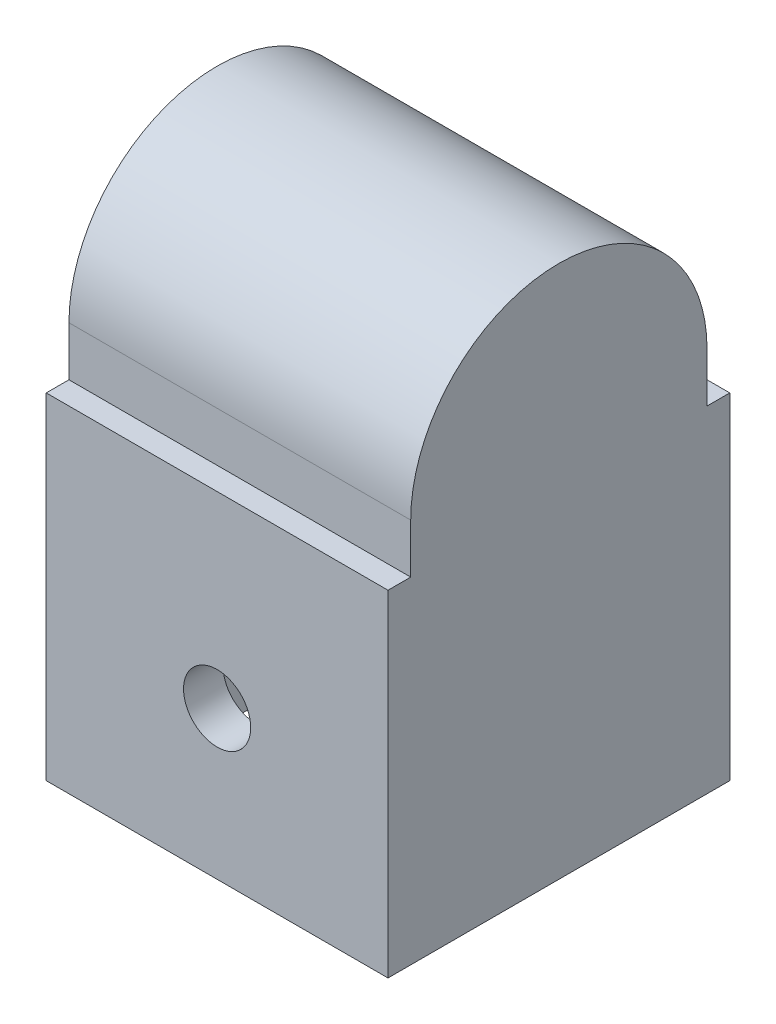
from build123d import *

# Parameters (mm, degrees)
CROQUIS3_W                   = 17.3
CROQUIS3_H                   = 17.3
CROQUIS3_W_2                 = 13.3
CROQUIS3_H_2                 = 13.3
SALIENTE_EXTRUIR1_DEPTH      = 15
CROQUIS3_2_W                 = 17.3
CROQUIS3_2_H                 = 17.3
CROQUIS3_2_W_2               = 13.3
CROQUIS3_2_H_2               = 13.3
SALIENTE_EXTRUIR2_DEPTH      = 2
CORTAR_EXTRUIR1_DEPTH        = 20.3557485
CORTAR_EXTRUIR1_DEPTH_BACK   = 20.3557485
CROQUIS5_R                   = 1.7
SALIENTE_EXTRUIR4_DEPTH      = 8.65
SALIENTE_EXTRUIR4_DEPTH_BACK = 8.65
VACIADO1_START               = -6.65
VACIADO1_DEPTH               = 13.3


# Read off the part's stored shape, not the designer's step: Vaciado1
with BuildPart() as part:
    # Croquis3 → Saliente-Extruir1 (new body)
    with BuildSketch(Plane(origin=(0, 0, 0), x_dir=(1, 0, 0), z_dir=(0, 1, 0))):
        Rectangle(CROQUIS3_W, CROQUIS3_H)
        Rectangle(CROQUIS3_W_2, CROQUIS3_H_2, mode=Mode.SUBTRACT)
    extrude(amount=-SALIENTE_EXTRUIR1_DEPTH)

    # Croquis3<2> → Saliente-Extruir2 (add)
    # profile 1 of 2: a face of its own
    with BuildSketch(Plane(origin=(0, 0, 0), x_dir=(1, 0, 0), z_dir=(0, 1, 0))):
        Rectangle(CROQUIS3_2_W, CROQUIS3_2_H)
        Rectangle(CROQUIS3_2_W_2, CROQUIS3_2_H_2, mode=Mode.SUBTRACT)
    # profile 2 of 2: a face of its own
    with BuildSketch(Plane(origin=(0, 0, 0), x_dir=(1, 0, 0), z_dir=(0, 1, 0))):
        Rectangle(CROQUIS3_2_W_2, CROQUIS3_2_H_2)
    extrude(amount=SALIENTE_EXTRUIR2_DEPTH)

    # Croquis5 → Cortar-Extruir1 (cut, two sides: drawn at the far end of the back side and taken through both)
    with BuildSketch(Plane.XY.offset(-CORTAR_EXTRUIR1_DEPTH_BACK)):
        with Locations((0, -7.5)):
            Circle(CROQUIS5_R)
    extrude(amount=CORTAR_EXTRUIR1_DEPTH + CORTAR_EXTRUIR1_DEPTH_BACK, mode=Mode.SUBTRACT)

    # Croquis7 → Saliente-Extruir4 (add, two sides: drawn at the far end of the back side and taken through both)
    with BuildSketch(Plane(origin=(0, 0, 0), x_dir=(0, 0, -1), z_dir=(1, 0, 0)).offset(-SALIENTE_EXTRUIR4_DEPTH_BACK)):
        with BuildLine():
            Line((-7.5, 4.5), (-7.5, 2))
            Line((-7.5, 2), (7.5, 2))
            Line((7.5, 2), (7.5, 4.5))
            ThreePointArc((7.5, 4.5), (0, 12), (-7.5, 4.5))
        make_face()
    extrude(amount=SALIENTE_EXTRUIR4_DEPTH + SALIENTE_EXTRUIR4_DEPTH_BACK)

    # Vaciado1 outline → Vaciado1 (cut)
    with BuildSketch(Plane.YZ.offset(VACIADO1_START)):
        with BuildLine():
            Line((2, 5.5), (2, -5.5))
            Line((2, -5.5), (4.5, -5.5))
            ThreePointArc((4.5, -5.5), (10, 0), (4.5, 5.5))
            Line((4.5, 5.5), (2, 5.5))
        make_face()
    extrude(amount=VACIADO1_DEPTH, mode=Mode.SUBTRACT)


solid = part.part
